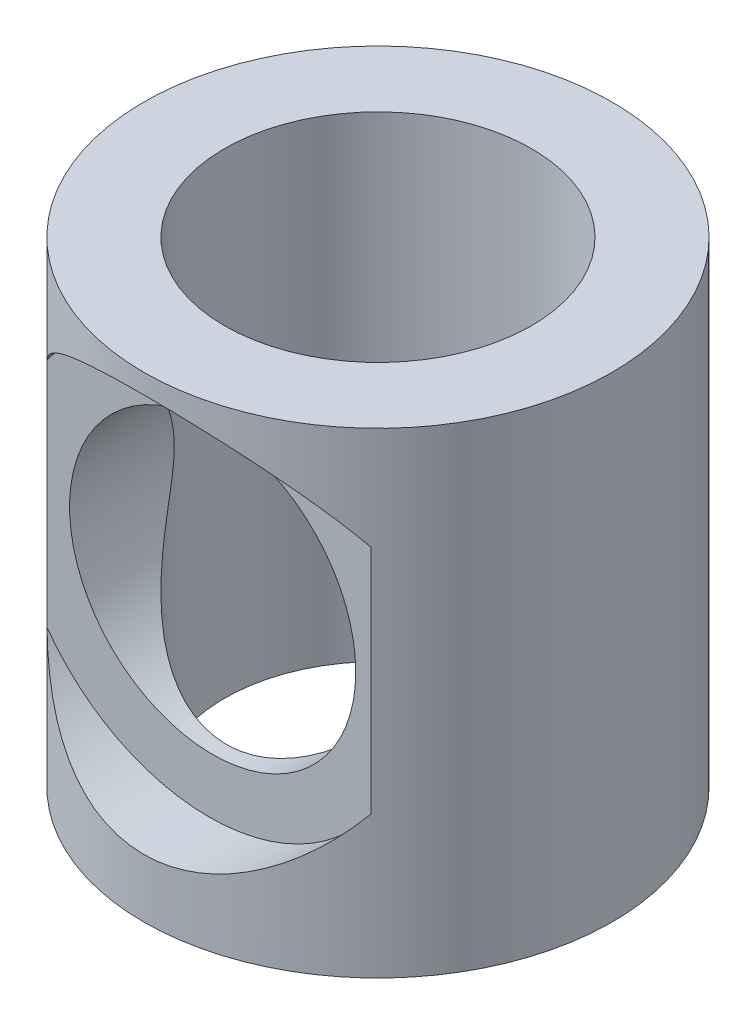
from build123d import *

# Parameters (mm, degrees)
SKETCH1_R               = 9
SKETCH1_R_2             = 5.9
BOSS_EXTRUDE1_DEPTH     = 18.3
CUT_EXTRUDE5_START      = 6.5
SKETCH3_R               = 7.65
CUT_EXTRUDE5_DEPTH      = 16.791029586
CUT_EXTRUDE6_DEPTH      = 26.615230012
CUT_EXTRUDE6_DEPTH_BACK = 7
SKETCH6_R               = 5.5


with BuildPart() as part:
    # Sketch1 → Boss-Extrude1 (new body)
    with BuildSketch(Plane(origin=(0, 0, 0), x_dir=(1, 0, 0), z_dir=(0, 1, 0))):
        Circle(SKETCH1_R)
        Circle(SKETCH1_R_2, mode=Mode.SUBTRACT)
    extrude(amount=-BOSS_EXTRUDE1_DEPTH)

    # Sketch3 → Cut-Extrude5 (cut, through all)
    with BuildSketch(Plane.XY.offset(CUT_EXTRUDE5_START)):
        with Locations((0, -8.4)):
            Circle(SKETCH3_R)
    extrude(amount=CUT_EXTRUDE5_DEPTH, mode=Mode.SUBTRACT)

    # Sketch6 → Cut-Extrude6 (cut, two sides: drawn at the far end of the back side and taken through both)
    with BuildSketch(Plane.XY.offset(6.5).offset(-CUT_EXTRUDE6_DEPTH_BACK)):
        with Locations((0.145476138, -8.4)):
            Circle(SKETCH6_R)
    extrude(amount=CUT_EXTRUDE6_DEPTH + CUT_EXTRUDE6_DEPTH_BACK, mode=Mode.SUBTRACT)


solid = part.part
